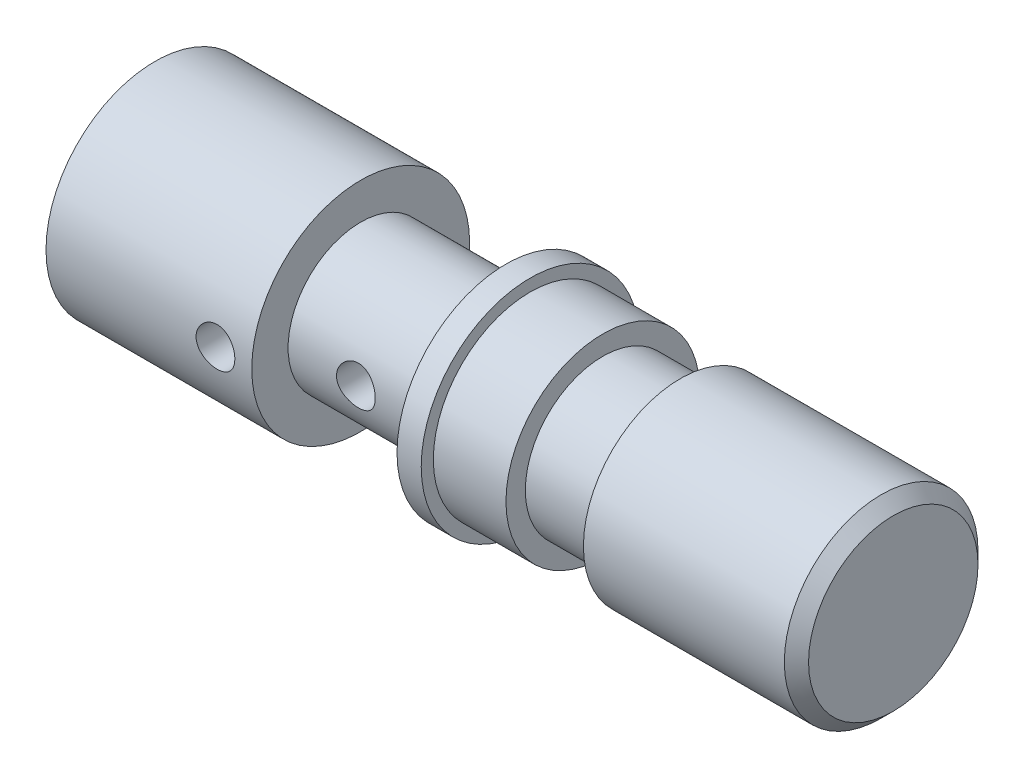
from build123d import *

# Parameters (mm, degrees)
FL_CHE_START                         = -6
FL_CHE_VERSCHIEBEN1_2_OUTLINE_R      = 1.25
FL_CHE_VERSCHIEBEN1_2_DEPTH          = 12
FL_CHE_START_2                       = 1.833034949
FL_CHE_VERSCHIEBEN1_3_OUTLINE_R      = 0.8
FL_CHE_VERSCHIEBEN1_3_DEPTH          = 4.166965051
SCHNITT_LINEAR_AUSTRAGEN1_DEPTH      = 20
SCHNITT_LINEAR_AUSTRAGEN1_DEPTH_BACK = 4.5
SKIZZE1_R                            = 4.5
SKIZZE2_R                            = 4
AUFSATZ_LINEAR_AUSTRAGEN1_DEPTH      = 15
SCHNITT_LINEAR_START                 = -1
SKIZZE3_R                            = 4.5
SKIZZE3_R_2                          = 3
SCHNITT_LINEAR_AUSTRAGEN2_DEPTH      = 6
FASE1_SIZE                           = 0.5
SCHNITT_LINEAR_AUSTRAGEN3_DEPTH      = 10
SCHNITT_LINEAR_AUSTRAGEN3_DEPTH_BACK = 10
SKIZZE5_R                            = 0.8


with BuildPart() as part:
    # Fläche verschieben1: read off the stored shape, not the designer's step
    # Fläche verschieben1 outline → Fläche verschieben1 (revolve)
    with BuildSketch(Plane.YX):
        with BuildLine():
            ThreePointArc((1.75, 26.8), (1.808578644, 26.941421356), (1.95, 27))
            Line((1.95, 27), (2, 27))
            Line((2, 27), (2, 33.85))
            Line((2, 33.85), (1.85, 34))
            Line((1.85, 34), (0, 34))
            Line((0, 34), (0, 10.18519763))
            Line((0, 10.18519763), (2, 8.983476392))
            Line((2, 8.983476392), (2, 0))
            Line((2, 0), (4.5, 0))
            Line((4.5, 0), (4.5, 20))
            Line((4.5, 20), (3, 20))
            Line((3, 20), (3, 26))
            Line((3, 26), (1.95, 26))
            ThreePointArc((1.95, 26), (1.808578644, 26.058578644), (1.75, 26.2))
            Line((1.75, 26.2), (1.75, 26.8))
        make_face()
    revolve(axis=Axis((0, 0, 0), (1, 0, 0)))

    # Fl_che verschieben1 2 outline → Fl_che verschieben1 2 (cut)
    with BuildSketch(Plane.XY.offset(FL_CHE_START)):
        with Locations((17, 0)):
            Circle(FL_CHE_VERSCHIEBEN1_2_OUTLINE_R)
    extrude(amount=FL_CHE_VERSCHIEBEN1_2_DEPTH, mode=Mode.SUBTRACT)

    # Fl_che verschieben1 3 outline → Fl_che verschieben1 3 (cut)
    with BuildSketch(Plane.XY.offset(FL_CHE_START_2)):
        with Locations((7, 0)):
            Circle(FL_CHE_VERSCHIEBEN1_3_OUTLINE_R)
    extrude(amount=FL_CHE_VERSCHIEBEN1_3_DEPTH, mode=Mode.SUBTRACT)

    # Skizze1 → Schnitt-Linear austragen1 (cut, two sides: drawn at the far end of the back side and taken through both)
    with BuildSketch(Plane(origin=(20, 0, 0), x_dir=(0, 0, -1), z_dir=(1, 0, 0)).offset(-SCHNITT_LINEAR_AUSTRAGEN1_DEPTH_BACK)):
        with Locations(Location((0, 0, 0), (0, 0, 180))):
            Circle(SKIZZE1_R)
    extrude(amount=SCHNITT_LINEAR_AUSTRAGEN1_DEPTH + SCHNITT_LINEAR_AUSTRAGEN1_DEPTH_BACK, mode=Mode.SUBTRACT)

    # Skizze2 → Aufsatz-Linear austragen1 (add)
    with BuildSketch(Plane(origin=(15.5, 0, 0), x_dir=(0, 0, -1), z_dir=(1, 0, 0))):
        Circle(SKIZZE2_R)
    extrude(amount=AUFSATZ_LINEAR_AUSTRAGEN1_DEPTH)

    # Skizze3 → Schnitt-Linear austragen2 (cut)
    with BuildSketch(Plane(origin=(15.5, 0, 0), x_dir=(0, 0, -1), z_dir=(1, 0, 0)).offset(SCHNITT_LINEAR_START)):
        with Locations(Location((0, 0, 0), (0, 0, 180))):
            Circle(SKIZZE3_R)
        Circle(SKIZZE3_R_2, mode=Mode.SUBTRACT)
    extrude(amount=-SCHNITT_LINEAR_AUSTRAGEN2_DEPTH, mode=Mode.SUBTRACT)

    # Skizze4 → Schnitt-Rotation1 (revolve, cut)
    with BuildSketch(Plane(origin=(0, 0, 0), x_dir=(1, 0, 0), z_dir=(0, 1, 0)), mode=Mode.PRIVATE) as schnitt_rotation1_sk:
        Polygon((18.5, 4), (18.5, 3.2), (21.5, 3.2), (21.7, 4), align=None)
    revolve(schnitt_rotation1_sk.sketch.rotate(Axis((17.168940626, 0, 0), (1, 0, 0)), 180), axis=Axis((17.168940626, 0, 0), (1, 0, 0)), mode=Mode.SUBTRACT)

    # Fase1
    fase1_edges = [part.edges().sort_by_distance(p)[0] for p in [
        (30.5, 0, 4),
    ]]
    chamfer(fase1_edges, length=FASE1_SIZE)

    # Skizze5 → Schnitt-Linear austragen3 (cut, two sides: drawn at the far end of the back side and taken through both)
    with BuildSketch(Plane.XY.offset(-SCHNITT_LINEAR_AUSTRAGEN3_DEPTH_BACK)):
        with Locations(Location((11.3, 0, 0), (0, 0, 180))):
            Circle(SKIZZE5_R)
    extrude(amount=SCHNITT_LINEAR_AUSTRAGEN3_DEPTH + SCHNITT_LINEAR_AUSTRAGEN3_DEPTH_BACK, mode=Mode.SUBTRACT)


solid = part.part
